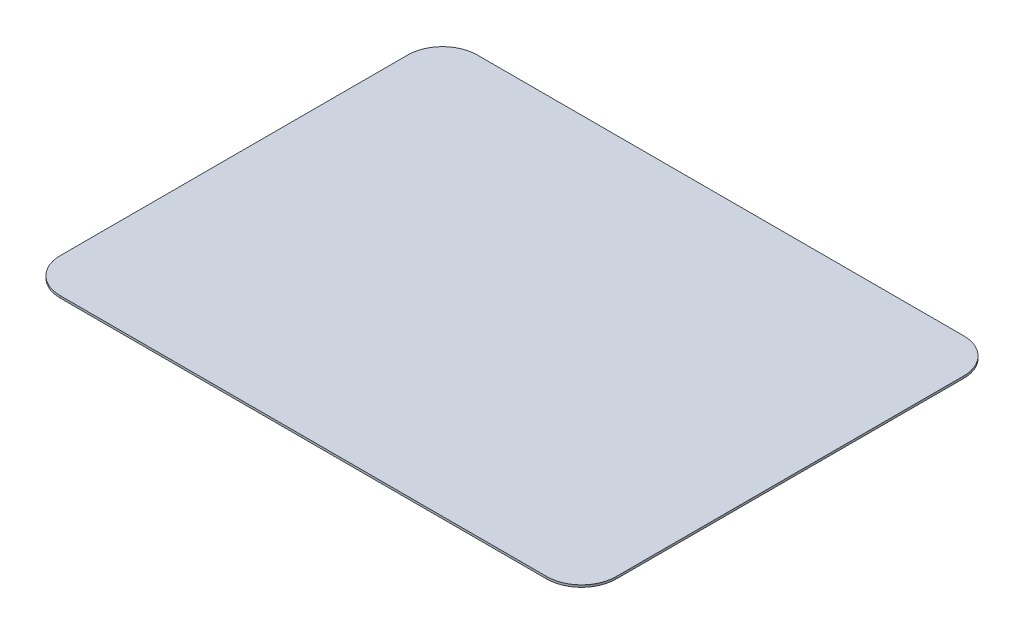
from build123d import *

# Parameters (mm, degrees)
MAINBODY_DEPTH = 0.79375


with BuildPart() as part:
    # Sketch1 → MainBody (new body)
    with BuildSketch(Plane(origin=(0, 6.731, 0), x_dir=(1, 0, 0), z_dir=(0, 1, 0))):
        with BuildLine():
            Line((101.6, -63.5), (101.6, 63.5))
            ThreePointArc((101.6, 63.5), (97.880256121, 72.480256121), (88.9, 76.2))
            Line((88.9, 76.2), (-88.9, 76.2))
            ThreePointArc((-88.9, 76.2), (-97.880256121, 72.480256121), (-101.6, 63.5))
            Line((-101.6, 63.5), (-101.6, -63.5))
            ThreePointArc((-101.6, -63.5), (-97.880256121, -72.480256121), (-88.9, -76.2))
            Line((-88.9, -76.2), (88.9, -76.2))
            ThreePointArc((88.9, -76.2), (97.880256121, -72.480256121), (101.6, -63.5))
        make_face()
    extrude(amount=MAINBODY_DEPTH)


solid = part.part
